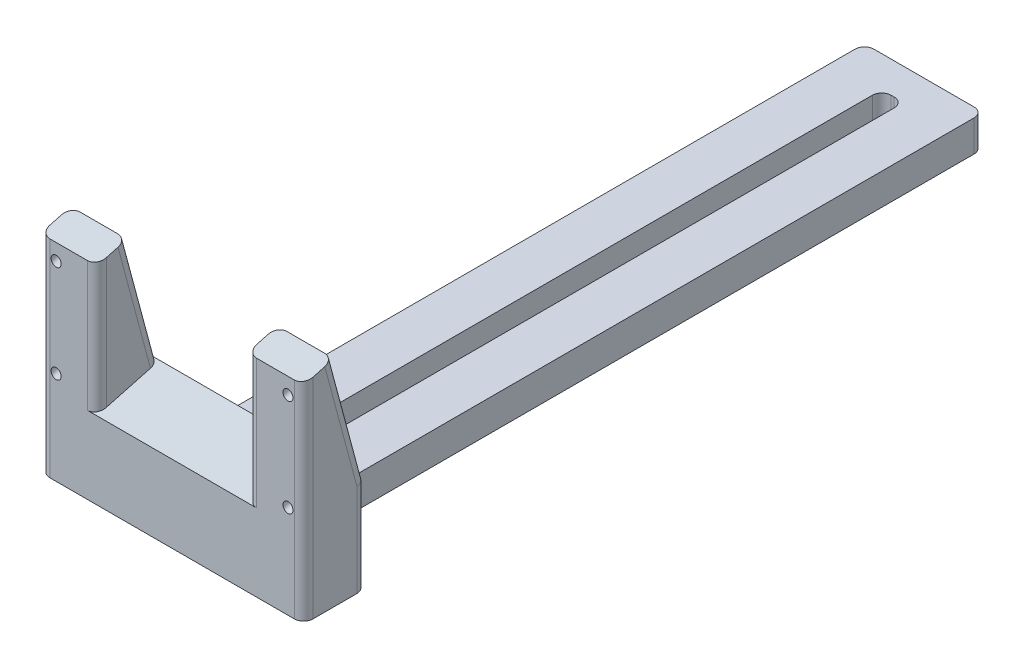
from build123d import *

# Parameters (mm, degrees)
SKETCH1_W                = 19
SKETCH1_H                = 120
SKETCH1_W_2              = 3.5
SKETCH1_H_2              = 100
BOSS_EXTRUDE1_DEPTH      = 5
BOSS_EXTRUDE2_DEPTH      = 11.5
BOSS_EXTRUDE2_DEPTH_BACK = 30.5
SKETCH4_R                = 0.8
SKETCH4_W                = 24
SKETCH4_H                = 20
CUT_EXTRUDE2_DEPTH       = 116.375880411
FILLET3_R                = 1.5


with BuildPart() as part:
    # Sketch1 → Boss-Extrude1 (new body)
    with BuildSketch(Plane(origin=(0, 0, 0), x_dir=(1, 0, 0), z_dir=(0, 1, 0))):
        with Locations((-9.5, 60)):
            Rectangle(SKETCH1_W, SKETCH1_H)
        with Locations((-9.5, 65)):
            Rectangle(SKETCH1_W_2, SKETCH1_H_2, mode=Mode.SUBTRACT)
    extrude(amount=BOSS_EXTRUDE1_DEPTH)

    # Sketch2 → Boss-Extrude2 (add, two sides: drawn at the far end of the back side and taken through both)
    with BuildSketch(Plane(origin=(0, 0, 0), x_dir=(0, 0, -1), z_dir=(1, 0, 0)).offset(-BOSS_EXTRUDE2_DEPTH_BACK)):
        Polygon((10, 15), (4.823619098, 34.318516526), (0, 33.026031684), (0, 15), (0, 5), (0, 0), (10, 0), (10, 5), align=None)
    extrude(amount=BOSS_EXTRUDE2_DEPTH + BOSS_EXTRUDE2_DEPTH_BACK)

    # Sketch4 → Cut-Extrude2 (cut, through all)
    with BuildSketch(Plane(origin=(0, 3.504809472, -13.080127019), x_dir=(-1, 0, 0), z_dir=(0, 0.25881904510252585, -0.965925826289067))):
        with Locations((-9, 29.400696943)):
            Circle(SKETCH4_R)
        with Locations((-9, 14.400696943)):
            Circle(SKETCH4_R)
        with Locations((28, 14.400696943)):
            Circle(SKETCH4_R)
        with Locations((28, 29.400696943)):
            Circle(SKETCH4_R)
        with Locations((9.5, 21.900696943)):
            Rectangle(SKETCH4_W, SKETCH4_H)
    extrude(amount=-CUT_EXTRUDE2_DEPTH, mode=Mode.SUBTRACT)

    # Fillet3
    fillet3_edges = [part.edges().sort_by_distance(p)[0] for p in [
        (11.5, 7.5, -10),
        (-21.5, 22.67326988, 0),
        (-30.5, 7.5, -10),
        (11.5, 24.659258263, -7.411809549),
        (-21.5, 24.659258263, -7.411809549),
        (-30.5, 24.659258263, -7.411809549),
        (11.5, 16.513015842, 0),
        (-30.5, 16.513015842, 0),
        (2.5, 22.67326988, 0),
        (2.5, 24.659258263, -7.411809549),
        (-9.5, 5, -10),
        (-7.75, 2.5, -15),
        (-11.25, 2.5, -15),
        (0, 2.5, -10),
        (-19, 2.5, -10),
        (-11.25, 2.5, -115),
        (-19, 2.5, -120),
        (-7.75, 2.5, -115),
        (0, 2.5, -120),
    ]]
    fillet(fillet3_edges, radius=FILLET3_R)


solid = part.part
